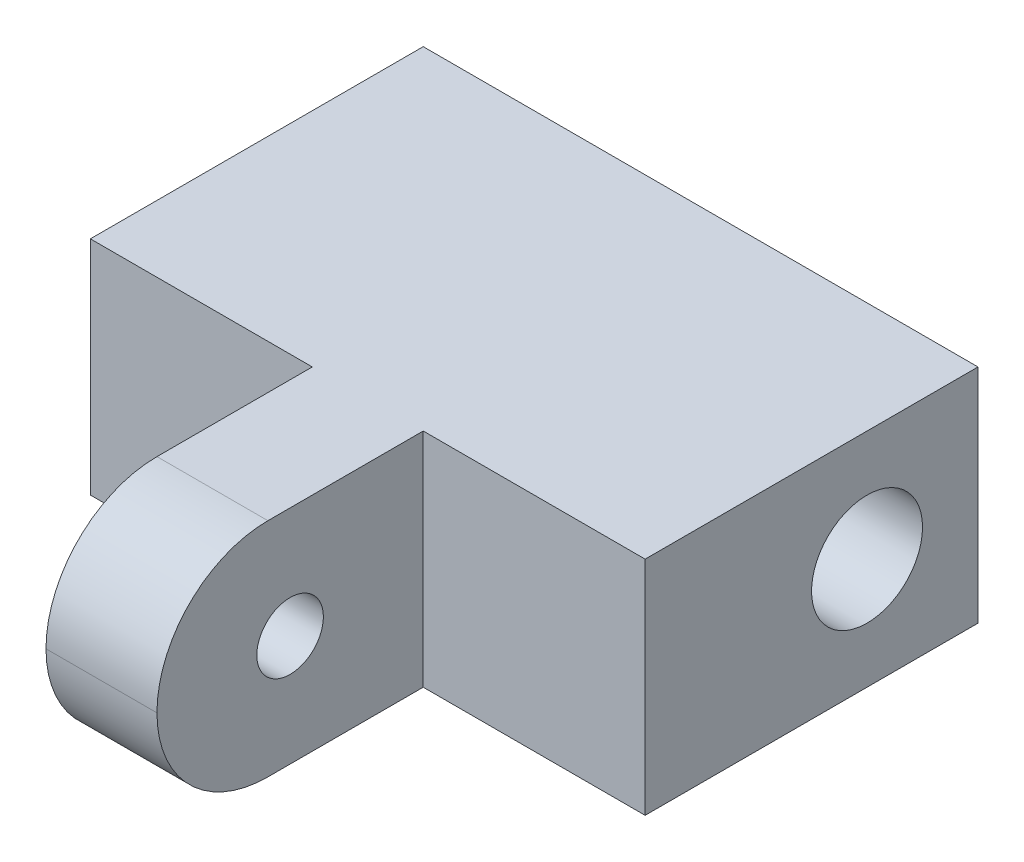
from build123d import *

# Parameters (mm, degrees)
BOSS_EXTRUDE1_DEPTH = 10
SKETCH2_R           = 2.5
SKETCH2_R_2         = 1.5
CUT_EXTRUDE1_DEPTH  = 39.13135193
FILLET1_R           = 5


with BuildPart() as part:
    # Sketch1 → Boss-Extrude1 (new body)
    with BuildSketch(Plane(origin=(0, 0, 0), x_dir=(1, 0, 0), z_dir=(0, 1, 0))):
        Polygon((2.5, 0), (-2.5, 0), (-2.5, 12), (-12.5, 12), (-12.5, 27), (12.5, 27), (12.5, 12), (2.5, 12), align=None)
    extrude(amount=BOSS_EXTRUDE1_DEPTH)

    # Sketch2 → Cut-Extrude1 (cut, through all)
    with BuildSketch(Plane(origin=(12.5, 0, 0), x_dir=(0, 0, -1), z_dir=(1, 0, 0))):
        with Locations((22, 5)):
            Circle(SKETCH2_R)
        with Locations((6, 5)):
            Circle(SKETCH2_R_2)
    extrude(amount=-CUT_EXTRUDE1_DEPTH, mode=Mode.SUBTRACT)

    # Fillet1
    fillet1_edges = [part.edges().sort_by_distance(p)[0] for p in [
        (0, 10, 0),
        (0, 0, 0),
    ]]
    fillet(fillet1_edges, radius=FILLET1_R - 0.0001)  # a hair under: the kernel refuses the full size


solid = part.part
